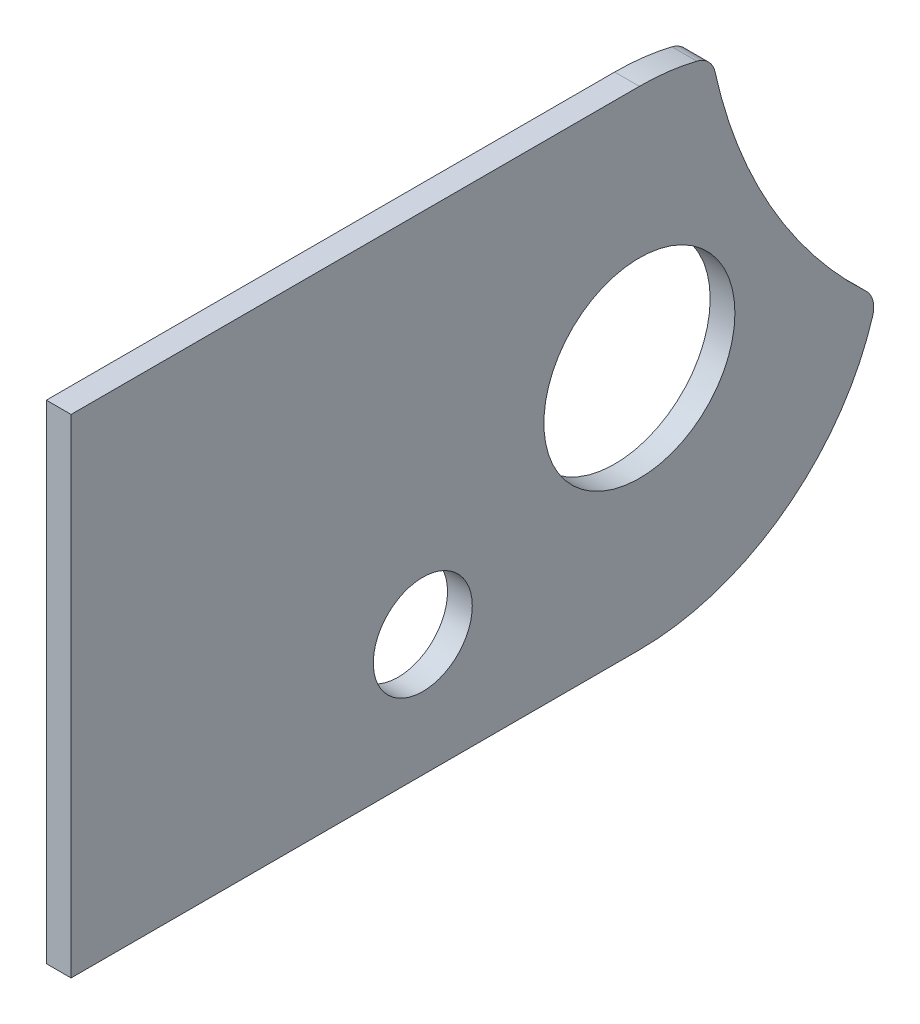
from build123d import *

# Parameters (mm, degrees)
SKETCH1_R               = 9.65
BASE_FLANGE1_DEPTH      = 2.5
CUT_EXTRUDE1_DEPTH      = 63.525520722
CUT_EXTRUDE1_DEPTH_BACK = 63.525520722
SKETCH2_R               = 5
SKETCH2_R_2             = 52.175
FILLET1_R               = 2.5
SCALE1_SCALE            = 1.5


# Sheet-metal steps are written as plain solids
with BuildPart() as part:
    # Sketch1 → Base-Flange1 (new body)
    with BuildSketch(Plane(origin=(0, 0, 0), x_dir=(0, 0, -1), z_dir=(1, 0, 0))):
        with BuildLine():
            Line((0, 24.65), (-57.40704, 24.65))
            Line((-57.40704, 24.65), (-57.40704, -24.65))
            Line((-57.40704, -24.65), (0, -24.65))
            ThreePointArc((0, -24.65), (24.65, 0), (0, 24.65))
        make_face()
        Circle(SKETCH1_R, mode=Mode.SUBTRACT)
    extrude(amount=-BASE_FLANGE1_DEPTH)

    # Sketch2 → Cut-Extrude1 (cut, two sides: drawn at the far end of the back side and taken through both)
    with BuildSketch(Plane(origin=(0, 0, 0), x_dir=(0, 0, -1), z_dir=(1, 0, 0)).offset(-CUT_EXTRUDE1_DEPTH_BACK)):
        with Locations((-21.8797706, -12.3562513)):
            Circle(SKETCH2_R)
        with Locations((58.59296, 33.3400694)):
            Circle(SKETCH2_R_2)
    extrude(amount=CUT_EXTRUDE1_DEPTH + CUT_EXTRUDE1_DEPTH_BACK, mode=Mode.SUBTRACT)

    # Fillet1
    fillet1_edges = [part.edges().sort_by_distance(p)[0] for p in [
        (-1.25, 23.529116974, -7.348683856),
        (-1.25, -5.701899087, -23.981468821),
    ]]
    fillet(fillet1_edges, radius=FILLET1_R)


with BuildPart() as part_1:
    # Scale1: scaled about (-1.25, -0.353186923, 22.904210984)
    add(part.part.scale(SCALE1_SCALE).moved(Location((0.625, 0.176593461, -11.452105492))))


solid = part_1.part
